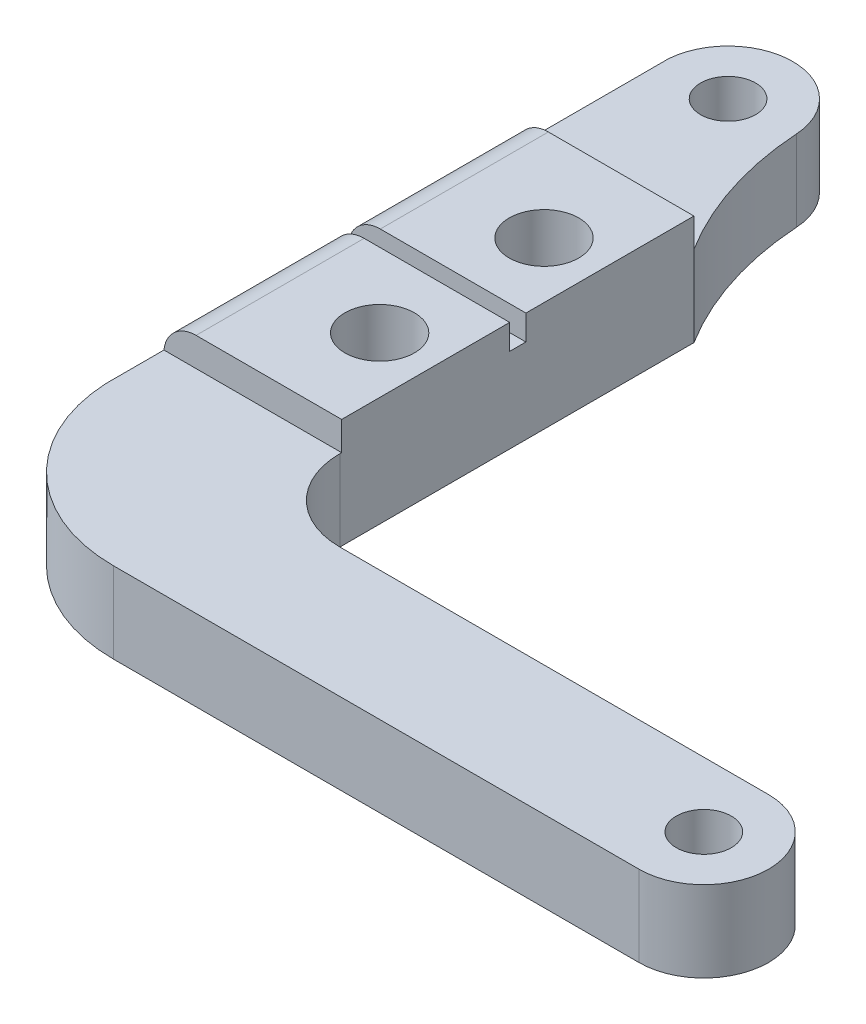
from build123d import *

# Parameters (mm, degrees)
BOSS_EXTRU_1_DEPTH      = 5
D_GAGEMENT_M31_D        = 3.4
ESQUISSE5_W             = 11
ESQUISSE5_H             = 21.78
BOSS_EXTRU_2_DEPTH      = 1.78
ESQUISSE6_W             = 1
ESQUISSE6_H             = 1.55
ENL_V_MAT_EXTRU_1_DEPTH = 65.375604075
D_GAGEMENT_M42_D        = 4.3
ESQUISSE9_W             = 5.11
ESQUISSE9_H             = 5
BOSS_EXTRU_3_DEPTH      = 3
CONG_2_R                = 5
CONG_3_R                = 10
CONG_4_R                = 2
CONG_5_R                = 20


with BuildPart() as part:
    # Esquisse2 → Boss.-Extru.1 (new body)
    with BuildSketch(Plane(origin=(0, 0, 0), x_dir=(1, 0, 0), z_dir=(0, 1, 0))):
        with BuildLine():
            Line((4, -36), (38.5, -36))
            ThreePointArc((38.5, -36), (42.5, -40), (38.5, -44))
            Line((38.5, -44), (-4, -44))
            Line((-4, -44), (-4, 0))
            ThreePointArc((-4, 0), (0, 4), (4, 0))
            Line((4, 0), (4, -9.11))
            Line((4, -9.11), (7, -9.11))
            Line((7, -9.11), (7, -30.89))
            Line((7, -30.89), (4, -30.89))
            Line((4, -30.89), (4, -36))
        make_face()
    extrude(amount=BOSS_EXTRU_1_DEPTH)

    # Dégagement M31 (through all)
    with Locations(Plane(origin=(0, 5, 0), x_dir=(1, 0, 0), z_dir=(0, 1, 0))):
        with Locations((0, 0), (38.5, -40)):
            Hole(D_GAGEMENT_M31_D / 2)

    # Esquisse5 → Boss.-Extru.2 (add)
    with BuildSketch(Plane(origin=(0, 5, 0), x_dir=(1, 0, 0), z_dir=(0, 1, 0))):
        with Locations((1.5, -20)):
            Rectangle(ESQUISSE5_W, ESQUISSE5_H)
    extrude(amount=BOSS_EXTRU_2_DEPTH)

    # Esquisse6 → Enlèv. mat.-Extru.1 (cut, through all)
    with BuildSketch(Plane.ZY.offset(4)):
        with Locations((20, 6.005)):
            Rectangle(ESQUISSE6_W, ESQUISSE6_H)
    extrude(amount=-ENL_V_MAT_EXTRU_1_DEPTH, mode=Mode.SUBTRACT)

    # Dégagement M42 (through all)
    with Locations(Plane(origin=(0, 6.78, 0), x_dir=(1, 0, 0), z_dir=(0, 1, 0))):
        with Locations((3.54, -25.08), (3.54, -14.92)):
            Hole(D_GAGEMENT_M42_D / 2)

    # Esquisse9 → Boss.-Extru.3 (add)
    with BuildSketch(Plane(origin=(4, 0, 0), x_dir=(0, 0, -1), z_dir=(1, 0, 0))):
        with Locations((-33.445, 2.5)):
            Rectangle(ESQUISSE9_W, ESQUISSE9_H)
    extrude(amount=BOSS_EXTRU_3_DEPTH)

    # Congé2
    cong_2_edges = [part.edges().sort_by_distance(p)[0] for p in [
        (7, 2.5, 36),
    ]]
    fillet(cong_2_edges, radius=CONG_2_R)

    # Congé3
    cong_3_edges = [part.edges().sort_by_distance(p)[0] for p in [
        (-4, 2.5, 44),
    ]]
    fillet(cong_3_edges, radius=CONG_3_R)

    # Congé4
    # the kernel refuses this fillet: 2 mm, written as the material it takes off along each edge
    with BuildSketch(Plane(origin=(-4, 6.78, -2.89), x_dir=(0, -1, 0), z_dir=(0, 0, 1)), Plane(origin=(-4, 6.78, 8.5), x_dir=(0, -1, 0), z_dir=(0, 0, 1))) as cong_4_piece_1:
        with BuildLine():
            CenterArc((CONG_4_R, CONG_4_R), CONG_4_R, 180, 90)
            Line((0, CONG_4_R), (-CONG_4_R * 0.02, CONG_4_R))
            Line((-CONG_4_R * 0.02, CONG_4_R), (-CONG_4_R * 0.02, -CONG_4_R * 0.02))
            Line((-CONG_4_R * 0.02, -CONG_4_R * 0.02), (CONG_4_R, -CONG_4_R * 0.02))
            Line((CONG_4_R, -CONG_4_R * 0.02), (CONG_4_R, 0))
        make_face()
    extrude(amount=34.39, mode=Mode.SUBTRACT)

    # Congé5
    # the kernel refuses this fillet: 20 mm, written as the material it adds along each edge
    with BuildSketch(Plane(origin=(4, 0, 9.11), x_dir=(1, 0, 0), z_dir=(0, 1, 0))) as cong_5_piece_1:
        with BuildLine():
            CenterArc((19.95301022, 10.611100059), CONG_5_R, 183.585953045, 28.45700877)
            Line((-0.00783163, 9.360183343), (-2.003915815, 9.235091672))
            ThreePointArc((-2.003915815, 9.235091672), (-2, 9.11), (-2, 0))
            Line((-2, 0), (0, -2))
            ThreePointArc((0, -2), (1.5, -2), (1.304698978, -1.061110006))
            Line((1.304698978, -1.061110006), (3, 0))
        make_face()
    extrude(amount=5)


solid = part.part
